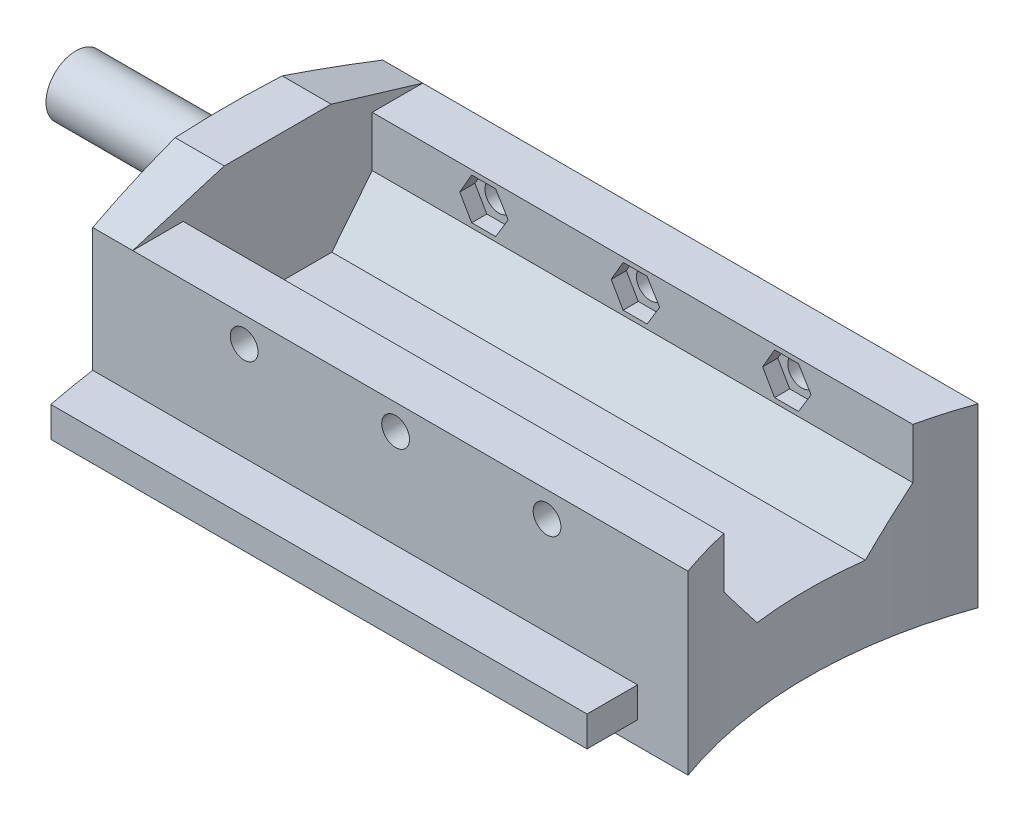
from build123d import *

# Parameters (mm, degrees)
SKETCH1_R                = 200
BOSS_EXTRUDE1_DEPTH      = 15
BOSS_EXTRUDE2_DEPTH      = 200
CUT_EXTRUDE1_DEPTH       = 286.087705803
CUT_EXTRUDE1_DEPTH_BACK  = 286.087705803
SKETCH3_R                = 85
CUT_EXTRUDE2_DEPTH       = 451.079120005
CUT_EXTRUDE2_DEPTH_BACK  = 451.079120005
SKETCH4_R                = 11
CUT_EXTRUDE3_DEPTH       = 451.079120105
CUT_EXTRUDE3_DEPTH_BACK  = 110
CUT_EXTRUDE4_DEPTH       = 110
BOSS_EXTRUDE3_DEPTH      = 200
CUT_EXTRUDE5_DEPTH       = 286.087705815
CUT_EXTRUDE5_DEPTH_BACK  = 286.087705815
SKETCH7_OUTSIDE_W        = 515.59
SKETCH7_OUTSIDE_H        = 515.59
SKETCH7_OUTSIDE_R        = 200
SKETCH9_R                = 5.9
BOSS_EXTRUDE4_DEPTH      = 230
CUT_EXTRUDE6_DEPTH       = 190
CUT_EXTRUDE8_DEPTH       = 307.879455313
CUT_EXTRUDE8_DEPTH_BACK  = 307.879455313
SKETCH12_OUTSIDE_W       = 584.34
SKETCH12_OUTSIDE_H       = 524.34
SKETCH12_OUTSIDE_W_2     = 160.728506479
SKETCH12_OUTSIDE_H_2     = 57.445626466
BOSS_EXTRUDE5_DEPTH      = 190
CUT_EXTRUDE10_DEPTH      = 198.357534097
CUT_EXTRUDE10_DEPTH_BACK = 198.357534097
SKETCH20_W               = 10
SKETCH20_H               = 6
BOSS_EXTRUDE6_DEPTH      = 200
CUT_EXTRUDE9_DEPTH       = 237.718926518
CUT_EXTRUDE9_DEPTH_BACK  = 237.718926518
SKETCH15_R               = 85
CUT_EXTRUDE11_START      = 4.5
CUT_EXTRUDE11_DEPTH      = 6
CUT_EXTRUDE12_DEPTH      = 10
CUT_EXTRUDE13_DEPTH      = 10
SKETCH25_R               = 2.75
CUT_EXTRUDE14_DEPTH      = 100
SKETCH26_R               = 3.05
CUT_EXTRUDE15_DEPTH      = 12.1
FILLET1_R                = 5
CUT_EXTRUDE16_DEPTH      = 3
LPATTERN1_COUNT          = 3
LPATTERN1_PITCH          = 30
CUT_EXTRUDE17_DEPTH      = 3
LPATTERN2_COUNT          = 3
LPATTERN2_PITCH          = 30
BOSS_EXTRUDE7_START      = 12.1
BOSS_EXTRUDE7_DEPTH      = 12.1


# Read off the part's stored shape, not the designer's step: Cut-Extrude11
with BuildPart() as part:
    # Sketch1 → Boss-Extrude1 (new body)
    with BuildSketch(Plane(origin=(0, 0, 0), x_dir=(1, 0, 0), z_dir=(0, 1, 0))):
        with Locations(Location((0, 0, 0), (0, 0, 270))):
            Circle(SKETCH1_R)
    extrude(amount=BOSS_EXTRUDE1_DEPTH)

    # Sketch2 → Boss-Extrude2 (add, symmetric)
    with BuildSketch(Plane.XY):
        Polygon((-25, 50.707142143), (25, 50.707142143), (60, 15), (-60, 15), align=None)
    extrude(amount=BOSS_EXTRUDE2_DEPTH, both=True)

    # Sketch3 → Cut-Extrude1 (cut, two sides: drawn at the far end of the back side and taken through both)
    with BuildSketch(Plane(origin=(0, 15, 0), x_dir=(1, 0, 0), z_dir=(0, 1, 0)).offset(-CUT_EXTRUDE1_DEPTH_BACK)):
        with Locations(Location((0, 0, 0), (0, 0, 270))):
            Circle(SKETCH3_R)
    extrude(amount=CUT_EXTRUDE1_DEPTH + CUT_EXTRUDE1_DEPTH_BACK, mode=Mode.SUBTRACT)

    # Sketch4 → Cut-Extrude2 (cut, two sides: drawn at the far end of the back side and taken through both)
    with BuildSketch(Plane(origin=(0, 0, -200), x_dir=(-1, 0, 0), z_dir=(0, 0, -1)).offset(-CUT_EXTRUDE2_DEPTH_BACK)):
        with Locations((0, 29)):
            Circle(SKETCH4_R)
    extrude(amount=CUT_EXTRUDE2_DEPTH + CUT_EXTRUDE2_DEPTH_BACK, mode=Mode.SUBTRACT)

    # Sketch5 → Cut-Extrude3 (cut, two sides: drawn at the far end of the back side and taken through both)
    with BuildSketch(Plane.XY.offset(200).offset(-CUT_EXTRUDE3_DEPTH_BACK)):
        Polygon((-25, 50.707142143), (25, 50.707142143), (50.198039412, 25), (25, 25), (25, 15), (-25, 15), (-25, 25), (-50.198039412, 25), align=None)
    extrude(amount=CUT_EXTRUDE3_DEPTH + CUT_EXTRUDE3_DEPTH_BACK, mode=Mode.SUBTRACT)

    # Sketch6 → Cut-Extrude4 (cut)
    with BuildSketch(Plane(origin=(0, 0, -200), x_dir=(-1, 0, 0), z_dir=(0, 0, -1))):
        Polygon((-25, 50.707142143), (25, 50.707142143), (50.198039412, 25), (25, 25), (25, 15), (-25, 15), (-25, 25), (-50.198039412, 25), align=None)
    extrude(amount=-CUT_EXTRUDE4_DEPTH, mode=Mode.SUBTRACT)

    # Sketch8 → Boss-Extrude3 (add, symmetric)
    with BuildSketch(Plane(origin=(0, 0, 0), x_dir=(0, 0, -1), z_dir=(1, 0, 0))):
        Polygon((0, 15), (-30, 15), (-29.95, 44.999958333), (29.95, 44.999958333), (30, 15), align=None)
    extrude(amount=BOSS_EXTRUDE3_DEPTH, both=True)

    # Sketch7 outside → Cut-Extrude5 (cut, two sides: drawn at the far end of the back side and taken through both)
    with BuildSketch(Plane(origin=(0, 15, 0), x_dir=(1, 0, 0), z_dir=(0, 1, 0)).offset(-CUT_EXTRUDE5_DEPTH_BACK)):
        Rectangle(SKETCH7_OUTSIDE_W, SKETCH7_OUTSIDE_H)
        with Locations(Location((0, 0, 0), (0, 0, 97.180755781))):
            Circle(SKETCH7_OUTSIDE_R, mode=Mode.SUBTRACT)
    extrude(amount=CUT_EXTRUDE5_DEPTH + CUT_EXTRUDE5_DEPTH_BACK, mode=Mode.SUBTRACT)

    # Sketch9 → Boss-Extrude4 (add, symmetric)
    with BuildSketch(Plane(origin=(0, 0, 0), x_dir=(0, 0, -1), z_dir=(1, 0, 0))):
        with Locations(Location((0, 29, 0), (0, 0, 180))):
            Circle(SKETCH9_R)
    extrude(amount=BOSS_EXTRUDE4_DEPTH, both=True)

    # Sketch10 → Cut-Extrude6 (cut, symmetric)
    with BuildSketch(Plane(origin=(0, 0, 0), x_dir=(0, 0, -1), z_dir=(1, 0, 0))):
        Polygon((-30, 15), (30, 15), (29.95, 44.999958333), (-29.95, 44.999958333), align=None)
    extrude(amount=CUT_EXTRUDE6_DEPTH, both=True, mode=Mode.SUBTRACT)

    # Sketch12 outside → Cut-Extrude8 (cut, two sides: drawn at the far end of the back side and taken through both)
    with BuildSketch(Plane(origin=(0, 15, 0), x_dir=(1, 0, 0), z_dir=(0, 1, 0)).offset(-CUT_EXTRUDE8_DEPTH_BACK)):
        Rectangle(SKETCH12_OUTSIDE_W, SKETCH12_OUTSIDE_H)
        with Locations((-160.364253239, 0)):
            Rectangle(SKETCH12_OUTSIDE_W_2, SKETCH12_OUTSIDE_H_2, mode=Mode.SUBTRACT)
    extrude(amount=CUT_EXTRUDE8_DEPTH + CUT_EXTRUDE8_DEPTH_BACK, mode=Mode.SUBTRACT)

    # Sketch14 → Boss-Extrude5 (add)
    with BuildSketch(Plane(origin=(0, 0, 0), x_dir=(0, 0, -1), z_dir=(1, 0, 0))):
        Polygon((-28.722813233, 15), (-28.722813233, 35), (-18.722813233, 35), (-18.722813233, 25), (-10.722813233, 15), align=None)
        Polygon((28.722813233, 15), (28.722813233, 35), (18.722813233, 35), (18.722813233, 25), (10.722813233, 15), align=None)
    extrude(amount=-BOSS_EXTRUDE5_DEPTH)

    # Sketch16 → Cut-Extrude10 (cut, two sides: drawn at the far end of the back side and taken through both)
    with BuildSketch(Plane(origin=(-190, 0, 0), x_dir=(0, 0, -1), z_dir=(1, 0, 0)).offset(-CUT_EXTRUDE10_DEPTH_BACK)):
        Polygon((-28.722813233, 35), (-10.596657492, 40.452365235), (10.596657492, 40.452365235), (28.722813233, 35), (31.38249, 46.365203084), (-30.991256821, 46.365203084), align=None)
    extrude(amount=CUT_EXTRUDE10_DEPTH + CUT_EXTRUDE10_DEPTH_BACK, mode=Mode.SUBTRACT)

    # Sketch20 → Boss-Extrude6 (add)
    with BuildSketch(Plane(origin=(0, 0, 0), x_dir=(0, 0, -1), z_dir=(1, 0, 0))):
        with Locations((-33.722813233, 7.5)):
            Rectangle(SKETCH20_W, SKETCH20_H)
        with Locations((33.722813233, 7.5)):
            Rectangle(SKETCH20_W, SKETCH20_H)
    extrude(amount=-BOSS_EXTRUDE6_DEPTH)

    # Sketch15 → Cut-Extrude9 (cut, two sides: drawn at the far end of the back side and taken through both)
    with BuildSketch(Plane(origin=(0, 0, 0), x_dir=(1, 0, 0), z_dir=(0, 1, 0)).offset(-CUT_EXTRUDE9_DEPTH_BACK)):
        Circle(SKETCH15_R)
    extrude(amount=CUT_EXTRUDE9_DEPTH + CUT_EXTRUDE9_DEPTH_BACK, mode=Mode.SUBTRACT)

    # Cut-Extrude11 outline → Cut-Extrude11 (cut)
    with BuildSketch(Plane(origin=(0, 0, 0), x_dir=(1, 0, 0), z_dir=(0, 1, 0)).offset(CUT_EXTRUDE11_START)):
        with BuildLine():
            ThreePointArc((-196.215554265, -38.722813233), (-197.13457286, -33.733665434), (-197.926754129, -28.722813233))
            Line((-197.926754129, -28.722813233), (-200, -28.722813233))
            Line((-200, -28.722813233), (-200, -38.722813233))
            Line((-200, -38.722813233), (-196.215554265, -38.722813233))
        make_face()
        with BuildLine():
            Line((-200, 28.722813233), (-197.926754129, 28.722813233))
            ThreePointArc((-197.926754129, 28.722813233), (-197.13457286, 33.733665434), (-196.215554265, 38.722813233))
            Line((-196.215554265, 38.722813233), (-200, 38.722813233))
            Line((-200, 38.722813233), (-200, 28.722813233))
        make_face()
    extrude(amount=CUT_EXTRUDE11_DEPTH, mode=Mode.SUBTRACT)

    # Sketch23 → Cut-Extrude12 (cut)
    with BuildSketch(Plane(origin=(0, 0, -38.722813233), x_dir=(-1, 0, 0), z_dir=(0, 0, -1))):
        Polygon((75.667322771, 10.5), (80, 10.5), (90, 10.5), (90, 4.5), (75.667322771, 4.5), align=None)
    extrude(amount=-CUT_EXTRUDE12_DEPTH, mode=Mode.SUBTRACT)

    # Sketch24 → Cut-Extrude13 (cut)
    with BuildSketch(Plane.XY.offset(38.722813233)):
        Polygon((-75.667322771, 10.5), (-80, 10.5), (-90, 10.5), (-90, 4.5), (-75.667322771, 4.5), align=None)
    extrude(amount=-CUT_EXTRUDE13_DEPTH, mode=Mode.SUBTRACT)

    # Sketch25 → Cut-Extrude14 (cut)
    with BuildSketch(Plane.XY.offset(28.722813233)):
        with Locations((-167.926754129, 30)):
            Circle(SKETCH25_R)
        with Locations((-107.926754129, 30)):
            Circle(SKETCH25_R)
        with Locations((-137.926754129, 30)):
            Circle(SKETCH25_R)
    extrude(amount=-CUT_EXTRUDE14_DEPTH, mode=Mode.SUBTRACT)

    # Sketch26 → Cut-Extrude15 (cut)
    with BuildSketch(Plane.ZY.offset(230)):
        with Locations((0, 29)):
            Circle(SKETCH26_R)
    extrude(amount=-CUT_EXTRUDE15_DEPTH, mode=Mode.SUBTRACT)

    # Fillet1
    fillet1_edges = [part.edges().sort_by_distance(p)[0] for p in [
        (-199.912956058, 29, -5.9),
    ]]
    fillet(fillet1_edges, radius=FILLET1_R)

    # Sketch27 → Cut-Extrude16 (cut)
    with BuildSketch(Plane.XY.offset(-18.722813233)):
        Polygon((-167.926754129, 34.1), (-165.556754129, 34.1), (-163.060757334, 30), (-165.556754129, 25.9), (-167.926754129, 25.9), (-170.296754129, 25.9), (-172.663890233, 30), (-170.296754129, 34.1), align=None)
    cut_extrude16 = extrude(amount=-CUT_EXTRUDE16_DEPTH, mode=Mode.SUBTRACT)

    # LPattern1: Cut-Extrude16 ×3
    with Locations(*[(i * LPATTERN1_PITCH, 0, 0) for i in range(1, LPATTERN1_COUNT)]):
        add(cut_extrude16, mode=Mode.SUBTRACT)

    # Sketch28 → Cut-Extrude17 (cut)
    with BuildSketch(Plane(origin=(0, 0, 18.722813233), x_dir=(-1, 0, 0), z_dir=(0, 0, -1))):
        Polygon((107.926754129, 34.1), (110.296754129, 34.1), (112.663890233, 30), (110.296754129, 25.9), (107.926754129, 25.9), (105.556754129, 25.9), (103.189618025, 30), (105.556754129, 34.1), align=None)
    cut_extrude17 = extrude(amount=-CUT_EXTRUDE17_DEPTH, mode=Mode.SUBTRACT)

    # LPattern2: Cut-Extrude17 ×3
    with Locations(*[(-i * LPATTERN2_PITCH, 0, 0) for i in range(1, LPATTERN2_COUNT)]):
        add(cut_extrude17, mode=Mode.SUBTRACT)

    # Sketch29 → Boss-Extrude7 (add)
    with BuildSketch(Plane.ZY.offset(217.9).offset(BOSS_EXTRUDE7_START)):
        with BuildLine():
            Line((-1.673320053, 31.55), (1.673320053, 31.55))
            ThreePointArc((1.673320053, 31.55), (0, 32.05), (-1.673320053, 31.55))
        make_face()
    extrude(amount=-BOSS_EXTRUDE7_DEPTH)


solid = part.part
